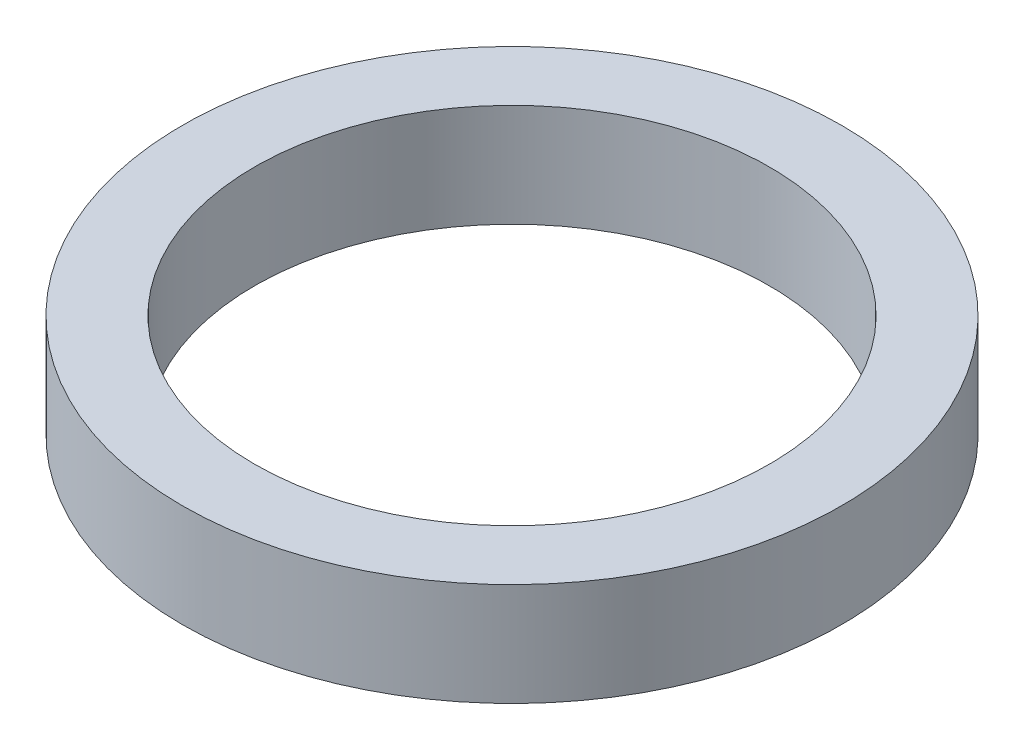
from build123d import *

# Parameters (mm, degrees)
SKETCH1_R           = 8
BOSS_EXTRUDE1_DEPTH = 2.5
SKETCH5_R           = 6.25
CUT_EXTRUDE2_DEPTH  = 25


with BuildPart() as part:
    # Sketch1 → Boss-Extrude1 (new body)
    with BuildSketch(Plane(origin=(0, 0, 0), x_dir=(1, 0, 0), z_dir=(0, 1, 0))):
        Circle(SKETCH1_R)
    extrude(amount=BOSS_EXTRUDE1_DEPTH)

    # Sketch5 → Cut-Extrude2 (cut, symmetric)
    with BuildSketch(Plane(origin=(0, 2.5, 0), x_dir=(1, 0, 0), z_dir=(0, 1, 0))):
        Circle(SKETCH5_R)
    extrude(amount=CUT_EXTRUDE2_DEPTH, both=True, mode=Mode.SUBTRACT)


solid = part.part
